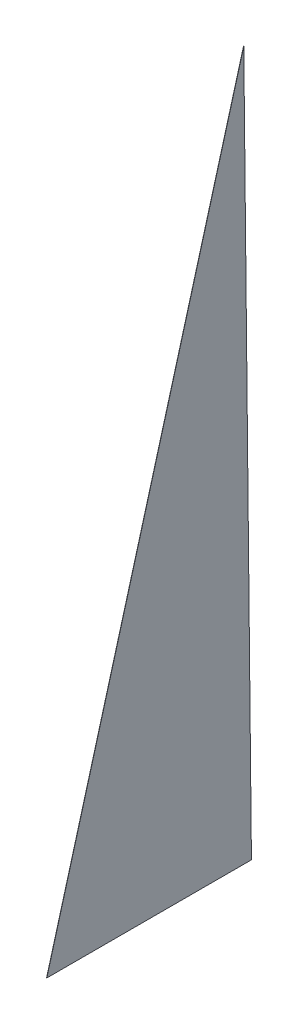
from build123d import *

# Parameters (mm, degrees)
BOSS_EXTRUDE1_DEPTH = 0.1984375


with BuildPart() as part:
    # Sketch1 → Boss-Extrude1 (new body)
    with BuildSketch(Plane(origin=(0, 0, 0), x_dir=(0, 0, -1), z_dir=(1, 0, 0))):
        Polygon((0, 0), (168.45, 605.88), (175, 0), align=None)
    extrude(amount=BOSS_EXTRUDE1_DEPTH)


solid = part.part
